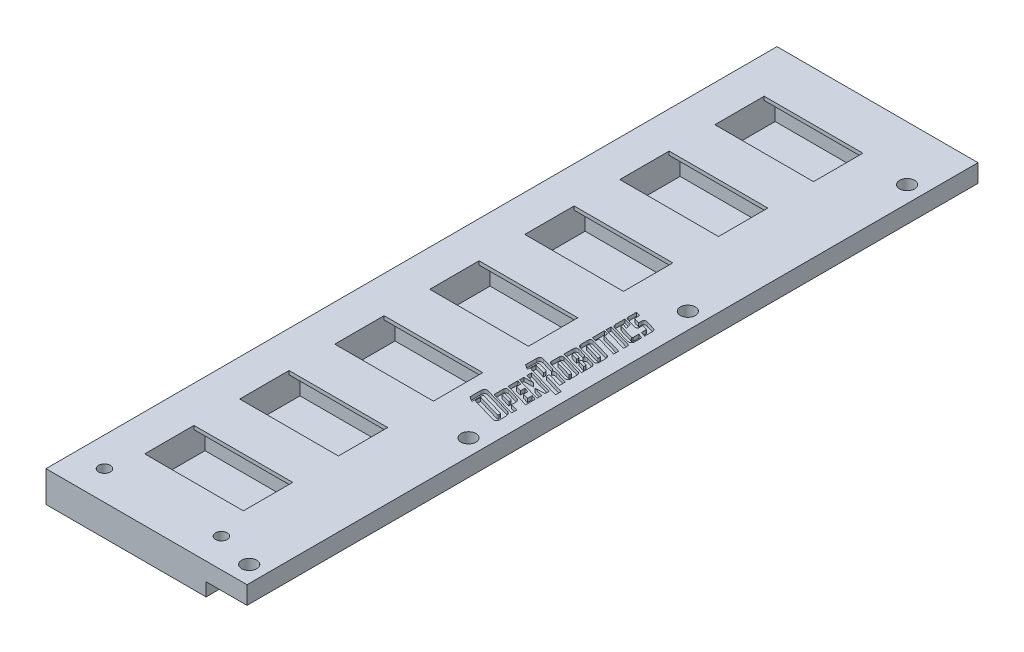
from build123d import *

# Parameters (mm, degrees)
ESQUISSE1_W                = 55
ESQUISSE1_H                = 200
ESQUISSE1_R                = 1.6
BOSS_EXTRU_1_DEPTH         = 8.5
ESQUISSE2_W                = 27
ESQUISSE2_H                = 16.5
ENL_V_MAT_EXTRU_1_DEPTH    = 7.5
ESQUISSE4_W                = 27
ESQUISSE4_H                = 3
BOSS_EXTRU_2_DEPTH         = 1
CONG_1_R                   = 1
R_P_TITION_START           = 10
R_P_TITION_LIN_AIRE4_DEPTH = 27
ESQUISSE8_W                = 11.2
ESQUISSE8_H                = 200
ENL_V_MAT_EXTRU_5_DEPTH    = 3.6
ENL_V_MAT_EXTRU_6_REACH    = 209.483
ESQUISSE9_R                = 2.05
ENL_V_MAT_EXTRU_7_REACH    = 209.599
ESQUISSE10_R               = 1.6
ENL_V_MAT_EXTRU_8_DEPTH    = 1


# Read off the part's stored shape, not the designer's step: Répétition linéaire4
with BuildPart() as part:
    # Esquisse1 → Boss.-Extru.1 (new body)
    with BuildSketch(Plane(origin=(0, 0, 0), x_dir=(1, 0, 0), z_dir=(0, 1, 0))):
        with Locations((27.5, 100)):
            Rectangle(ESQUISSE1_W, ESQUISSE1_H)
        with Locations(Location((8, 8, 0), (0, 0, 270))):
            Circle(ESQUISSE1_R, mode=Mode.SUBTRACT)
    extrude(amount=BOSS_EXTRU_1_DEPTH)

    # Esquisse2 → Enlèv. mat.-Extru.1 (cut)
    with BuildSketch(Plane(origin=(0, 8.5, 0), x_dir=(1, 0, 0), z_dir=(0, 1, 0))):
        with Locations((23.5, 25.25)):
            Rectangle(ESQUISSE2_W, ESQUISSE2_H)
        with Locations((23.5, 51.25)):
            Rectangle(ESQUISSE2_W, ESQUISSE2_H)
        with Locations((23.5, 77.25)):
            Rectangle(ESQUISSE2_W, ESQUISSE2_H)
        with Locations((23.5, 103.25)):
            Rectangle(ESQUISSE2_W, ESQUISSE2_H)
        with Locations((23.5, 129.25)):
            Rectangle(ESQUISSE2_W, ESQUISSE2_H)
        with Locations((23.5, 155.25)):
            Rectangle(ESQUISSE2_W, ESQUISSE2_H)
        with Locations((23.5, 181.25)):
            Rectangle(ESQUISSE2_W, ESQUISSE2_H)
    extrude(amount=-ENL_V_MAT_EXTRU_1_DEPTH, mode=Mode.SUBTRACT)

    # Esquisse4 → Boss.-Extru.2 (add)
    with BuildSketch(Plane(origin=(0, 8.5, 0), x_dir=(1, 0, 0), z_dir=(0, 1, 0))):
        with Locations((23.5, 32)):
            Rectangle(ESQUISSE4_W, ESQUISSE4_H)
        with Locations((23.5, 58)):
            Rectangle(ESQUISSE4_W, ESQUISSE4_H)
        with Locations((23.5, 84)):
            Rectangle(ESQUISSE4_W, ESQUISSE4_H)
        with Locations((23.5, 110)):
            Rectangle(ESQUISSE4_W, ESQUISSE4_H)
        with Locations((23.5, 136)):
            Rectangle(ESQUISSE4_W, ESQUISSE4_H)
        with Locations((23.5, 162)):
            Rectangle(ESQUISSE4_W, ESQUISSE4_H)
        with Locations((23.5, 188)):
            Rectangle(ESQUISSE4_W, ESQUISSE4_H)
    extrude(amount=-BOSS_EXTRU_2_DEPTH)

    # Congé1
    cong_1_edges = [part.edges().sort_by_distance(p)[0] for p in [
        (23.5, 7.5, -33.5),
    ]]
    fillet(cong_1_edges, radius=CONG_1_R)

    # Répétition linéaire4 outline → Répétition linéaire4 (add)
    with BuildSketch(Plane.YZ.offset(R_P_TITION_START)):
        with BuildLine():
            ThreePointArc((7.5, -58.5), (7.207106781, -59.207106781), (6.5, -59.5))
            Line((6.5, -59.5), (7.5, -59.5))
            Line((7.5, -59.5), (7.5, -58.5))
        make_face()
        with BuildLine():
            ThreePointArc((7.5, -84.5), (7.207106781, -85.207106781), (6.5, -85.5))
            Line((6.5, -85.5), (7.5, -85.5))
            Line((7.5, -85.5), (7.5, -84.5))
        make_face()
        with BuildLine():
            ThreePointArc((7.5, -110.5), (7.207106781, -111.207106781), (6.5, -111.5))
            Line((6.5, -111.5), (7.5, -111.5))
            Line((7.5, -111.5), (7.5, -110.5))
        make_face()
        with BuildLine():
            ThreePointArc((7.5, -136.5), (7.207106781, -137.207106781), (6.5, -137.5))
            Line((6.5, -137.5), (7.5, -137.5))
            Line((7.5, -137.5), (7.5, -136.5))
        make_face()
        with BuildLine():
            ThreePointArc((7.5, -162.5), (7.207106781, -163.207106781), (6.5, -163.5))
            Line((6.5, -163.5), (7.5, -163.5))
            Line((7.5, -163.5), (7.5, -162.5))
        make_face()
        with BuildLine():
            ThreePointArc((7.5, -188.5), (7.207106781, -189.207106781), (6.5, -189.5))
            Line((6.5, -189.5), (7.5, -189.5))
            Line((7.5, -189.5), (7.5, -188.5))
        make_face()
    extrude(amount=R_P_TITION_LIN_AIRE4_DEPTH)

    # Esquisse8 → Enlèv. mat.-Extru.5 (cut)
    with BuildSketch(Plane.XZ):
        with Locations((49.4, -100)):
            Rectangle(ESQUISSE8_W, ESQUISSE8_H)
    extrude(amount=-ENL_V_MAT_EXTRU_5_DEPTH, mode=Mode.SUBTRACT)

    # Esquisse9 → Enlèv. mat.-Extru.6 (cut, up to next)
    with BuildSketch(Plane.XZ.offset(-3.6), mode=Mode.PRIVATE) as enl_v_mat_extru_6_sk1:
        with Locations(Location((50.5, -185.1, 0), (0, 0, 270))):
            Circle(ESQUISSE9_R)
    enl_v_mat_extru_6_tool1 = extrude(enl_v_mat_extru_6_sk1.sketch, amount=-ENL_V_MAT_EXTRU_6_REACH, mode=Mode.PRIVATE) & part.part
    # Esquisse9 → Enlèv. mat.-Extru.6 (cut, up to next)
    with BuildSketch(Plane.XZ.offset(-3.6), mode=Mode.PRIVATE) as enl_v_mat_extru_6_sk2:
        with Locations(Location((50.5, -125.1, 0), (0, 0, 270))):
            Circle(ESQUISSE9_R)
    enl_v_mat_extru_6_tool2 = extrude(enl_v_mat_extru_6_sk2.sketch, amount=-ENL_V_MAT_EXTRU_6_REACH, mode=Mode.PRIVATE) & part.part
    # Esquisse9 → Enlèv. mat.-Extru.6 (cut, up to next)
    with BuildSketch(Plane.XZ.offset(-3.6), mode=Mode.PRIVATE) as enl_v_mat_extru_6_sk3:
        with Locations(Location((50.5, -65.1, 0), (0, 0, 270))):
            Circle(ESQUISSE9_R)
    enl_v_mat_extru_6_tool3 = extrude(enl_v_mat_extru_6_sk3.sketch, amount=-ENL_V_MAT_EXTRU_6_REACH, mode=Mode.PRIVATE) & part.part
    # Esquisse9 → Enlèv. mat.-Extru.6 (cut, up to next)
    with BuildSketch(Plane.XZ.offset(-3.6), mode=Mode.PRIVATE) as enl_v_mat_extru_6_sk4:
        with Locations(Location((50.5, -5.1, 0), (0, 0, 270))):
            Circle(ESQUISSE9_R)
    enl_v_mat_extru_6_tool4 = extrude(enl_v_mat_extru_6_sk4.sketch, amount=-ENL_V_MAT_EXTRU_6_REACH, mode=Mode.PRIVATE) & part.part
    add(enl_v_mat_extru_6_tool1.solids().sort_by_distance((50.5, 3.6, -185.1))[0], mode=Mode.SUBTRACT)
    add(enl_v_mat_extru_6_tool2.solids().sort_by_distance((50.5, 3.6, -125.1))[0], mode=Mode.SUBTRACT)
    add(enl_v_mat_extru_6_tool3.solids().sort_by_distance((50.5, 3.6, -65.1))[0], mode=Mode.SUBTRACT)
    add(enl_v_mat_extru_6_tool4.solids().sort_by_distance((50.5, 3.6, -5.1))[0], mode=Mode.SUBTRACT)

    # Esquisse10 → Enlèv. mat.-Extru.7 (cut, up to next)
    with BuildSketch(Plane(origin=(0, 8.5, 0), x_dir=(1, 0, 0), z_dir=(0, 1, 0)), mode=Mode.PRIVATE) as enl_v_mat_extru_7_sk1:
        with Locations(Location((40, 8, 0), (0, 0, 270))):
            Circle(ESQUISSE10_R)
    enl_v_mat_extru_7_tool1 = extrude(enl_v_mat_extru_7_sk1.sketch, amount=-ENL_V_MAT_EXTRU_7_REACH, mode=Mode.PRIVATE) & part.part
    add(enl_v_mat_extru_7_tool1.solids().sort_by_distance((40, 8.5, -8))[0], mode=Mode.SUBTRACT)

    # Esquisse11 → Enlèv. mat.-Extru.8 (cut)
    # profile 1 of 12: a face of its own
    with BuildSketch(Plane(origin=(0, 8.5, 0), x_dir=(1, 0, 0), z_dir=(0, 1, 0))):
        with BuildLine():
            add(Edge.make_bspline(
                [(42.66842272, 77.170687726), (42.643547924, 77.176950055), (42.597373101, 77.18857475), (42.530846571, 77.191819944), (42.473223056, 77.182377769), (42.425768384, 77.155158229), (42.390732732, 77.112821846), (42.364377795, 77.058290871), (42.350823605, 76.989410751), (42.34897761, 76.939226193), (42.347972973, 76.9119145)],
                knots=[0, 0, 0, 0, 1.200744757, 2.228929884, 3.104743097, 3.903101275, 4.735424252, 5.644967986, 6.718332635, 8, 8, 8, 8], degree=3))
            Line((42.347972973, 76.9119145), (42.347972973, 74.168650142))
            Line((42.347972973, 74.168650142), (40.975, 75.021395074))
            Line((40.975, 75.021395074), (40.975, 78.070360446))
            add(Edge.make_bspline(
                [(40.975, 78.070360446), (40.97604752, 78.112868835), (40.97807206, 78.195024722), (40.992995894, 78.313030642), (41.016306747, 78.421754486), (41.052072861, 78.519671666), (41.0940967, 78.610259861), (41.14982605, 78.688788365), (41.213547003, 78.759104447), (41.288040676, 78.817603641), (41.368918052, 78.867111246), (41.45613035, 78.904909914), (41.54786964, 78.93229352), (41.644905599, 78.946366572), (41.746481881, 78.950430318), (41.852844141, 78.94310947), (41.964417743, 78.926299639), (42.038877575, 78.905589102), (42.077132601, 78.894948706)],
                knots=[0, 0, 0, 0, 1.226733108, 2.370904843, 3.42883185, 4.428597837, 5.374906879, 6.301845232, 7.196621362, 8.105333785, 9.025784931, 9.927048389, 10.841512502, 11.781202374, 12.749592323, 13.770854027, 14.854737711, 16, 16, 16, 16], degree=3))
            Line((42.077132601, 78.894948706), (49.490382179, 76.736270496))
            add(Edge.make_bspline(
                [(49.490382179, 76.736270496), (49.538084982, 76.721546836), (49.630566191, 76.693002142), (49.760513344, 76.636056297), (49.877711951, 76.569426876), (49.981170535, 76.491775115), (50.074570001, 76.408744605), (50.155863607, 76.318248297), (50.229200899, 76.224138199), (50.292087605, 76.124696756), (50.346115885, 76.020522282), (50.391402479, 75.912470582), (50.428449061, 75.800056887), (50.462485467, 75.644763325), (50.492820435, 75.446667208), (50.497605357, 75.28655418), (50.5, 75.206424635)],
                knots=[0, 0, 0, 0, 1.055023788, 2.045369839, 2.993742388, 3.899182709, 4.775903371, 5.63226536, 6.467826204, 7.296355253, 8.116431915, 8.946684151, 9.771593619, 10.615292975, 12.306102633, 14, 14, 14, 14], degree=3))
            Line((50.5, 75.206424635), (50.5, 73.779819905))
            add(Edge.make_bspline(
                [(50.5, 73.779819905), (50.498868076, 73.738668509), (50.496658241, 73.658329408), (50.482286899, 73.539974117), (50.454721018, 73.427605995), (50.419417582, 73.320189749), (50.372773363, 73.220971311), (50.315323875, 73.1314478), (50.25007047, 73.049956609), (50.172689387, 72.980159445), (50.086175235, 72.920180848), (49.988997978, 72.872970731), (49.881581169, 72.840383256), (49.765878984, 72.816548038), (49.639653971, 72.809402321), (49.503484732, 72.81642804), (49.356588736, 72.839561242), (49.256863618, 72.866224968), (49.204793074, 72.880147186)],
                knots=[0, 0, 0, 0, 1.038552891, 2.02754736, 3.001378466, 3.953615352, 4.876825356, 5.759105294, 6.632765402, 7.502924438, 8.378838219, 9.281709478, 10.216216551, 11.204889448, 12.255920638, 13.396389907, 14.640549183, 16, 16, 16, 16], degree=3))
            Line((49.204793074, 72.880147186), (42.539706503, 74.845751071))
            Line((42.539706503, 74.845751071), (42.539706503, 76.402412811))
            Line((42.539706503, 76.402412811), (48.887024916, 74.521278942))
            add(Edge.make_bspline(
                [(48.887024916, 74.521278942), (48.905681242, 74.516201599), (48.939947768, 74.506875921), (48.989340682, 74.502453609), (49.032282836, 74.506456191), (49.067693264, 74.523727474), (49.096214969, 74.550358467), (49.114615699, 74.588406387), (49.124839699, 74.635148883), (49.126259447, 74.669153155), (49.127027027, 74.687537388)],
                knots=[0, 0, 0, 0, 1.268310745, 2.32953697, 3.247763845, 4.062404139, 4.872795954, 5.766252807, 6.79233614, 8, 8, 8, 8], degree=3))
            Line((49.127027027, 74.687537388), (49.127027027, 75.066982067))
            add(Edge.make_bspline(
                [(49.127027027, 75.066982067), (49.126206075, 75.085804072), (49.124647072, 75.121547411), (49.114408413, 75.171710691), (49.095775344, 75.214847866), (49.056955457, 75.261465792), (48.988873418, 75.310821809), (48.92408683, 75.333411832), (48.888365709, 75.345867202)],
                knots=[0, 0, 0, 0, 0.845234919, 1.60511692, 2.287910993, 2.930576506, 4.307624333, 6, 6, 6, 6], degree=3))
            Line((48.888365709, 75.345867202), (42.66842272, 77.170687726))
        make_face()
    # profile 2 of 12: a face of its own
    with BuildSketch(Plane(origin=(0, 8.5, 0), x_dir=(1, 0, 0), z_dir=(0, 1, 0))):
        with BuildLine():
            Line((50.5, 78.276842709), (50.5, 76.877053858))
            Line((50.5, 76.877053858), (43.720945946, 78.860088064))
            Line((43.720945946, 78.860088064), (43.720945946, 81.333852844))
            add(Edge.make_bspline(
                [(43.720945946, 81.333852844), (43.721330707, 81.371022369), (43.722062051, 81.441673251), (43.738013078, 81.542102229), (43.759567189, 81.63256567), (43.792344902, 81.712621843), (43.832557632, 81.78299602), (43.879889095, 81.843088839), (43.931112216, 81.895774704), (44.009255055, 81.950946589), (44.120441529, 82.001887428), (44.269688924, 82.025025975), (44.428627625, 82.021853537), (44.534226177, 81.996046317), (44.588439611, 81.982797101)],
                knots=[0, 0, 0, 0, 1.023038278, 1.94456502, 2.796003671, 3.580575649, 4.32004926, 5.022267279, 5.684222913, 6.337178209, 7.649174294, 9.01205071, 10.466011207, 12, 12, 12, 12], degree=3))
            Line((44.588439611, 81.982797101), (47.767461993, 81.056308503))
            add(Edge.make_bspline(
                [(47.767461993, 81.056308503), (47.823748808, 81.037779963), (47.932297814, 81.002047711), (48.077044656, 80.916573116), (48.199380279, 80.81116195), (48.294260184, 80.682251709), (48.368284676, 80.541208541), (48.433005355, 80.394309088), (48.480710275, 80.239350799), (48.526263974, 80.024594398), (48.557236742, 79.749106706), (48.554577153, 79.473942606), (48.542456751, 79.261226594), (48.528252362, 79.11518893), (48.514659694, 78.982654945), (48.501650274, 78.89937521), (48.495513091, 78.860088064)],
                knots=[0, 0, 0, 0, 0.982032393, 1.89384743, 2.772561612, 3.647251032, 4.534363995, 5.415740716, 6.310496145, 7.222190243, 9.060574603, 10.902015397, 11.787137362, 12.599879193, 13.33949416, 14, 14, 14, 14], degree=3))
            Line((48.495513091, 78.860088064), (50.5, 78.276842709))
        make_face()
        with BuildLine():
            add(Edge.make_bspline(
                [(47.469805743, 79.656519652), (47.468013103, 79.689894054), (47.464779206, 79.750100977), (47.433858566, 79.82091728), (47.390284152, 79.860786229), (47.344422907, 79.889718295), (47.28249506, 79.913370407), (47.236141397, 79.927662849), (47.211032517, 79.935404787)],
                knots=[0, 0, 0, 0, 1.424374681, 2.56955061, 3.177697891, 3.925092158, 4.876062669, 6, 6, 6, 6], degree=3))
            Line((47.211032517, 79.935404787), (45.114030828, 80.556192371))
            add(Edge.make_bspline(
                [(45.114030828, 80.556192371), (45.093593608, 80.56143649), (45.055768808, 80.571142201), (45.000393528, 80.573613291), (44.951233046, 80.568474481), (44.908775568, 80.548837333), (44.87504828, 80.516450763), (44.851867652, 80.469891534), (44.837645642, 80.410887371), (44.836892585, 80.366787639), (44.836486486, 80.343006138)],
                knots=[0, 0, 0, 0, 1.160569768, 2.147959388, 3.044020818, 3.860211538, 4.679746554, 5.573090582, 6.691249472, 8, 8, 8, 8], degree=3))
            Line((44.836486486, 80.343006138), (44.836486486, 79.935404787))
            Line((44.836486486, 79.935404787), (47.469805743, 79.15640352))
            Line((47.469805743, 79.15640352), (47.469805743, 79.656519652))
        make_face(mode=Mode.SUBTRACT)
    # profile 3 of 12: a face of its own
    with BuildSketch(Plane(origin=(0, 8.5, 0), x_dir=(1, 0, 0), z_dir=(0, 1, 0))):
        Polygon((43.720945946, 82.72157455), (43.720945946, 85.372324128), (44.922297297, 85.01030977), (44.922297297, 83.768734601), (46.466891892, 83.332976577), (46.466891892, 84.547735868), (47.668243243, 84.195107067), (47.668243243, 82.981688571), (49.212837838, 82.517773875), (49.212837838, 83.806276831), (50.5, 83.342362135), (50.5, 80.738540344), align=None)
    # profile 4 of 12: a face of its own
    with BuildSketch(Plane(origin=(0, 8.5, 0), x_dir=(1, 0, 0), z_dir=(0, 1, 0))):
        Polygon((43.720945946, 85.81076374), (43.720945946, 87.006751915), (46.340857264, 87.052338908), (43.720945946, 87.821954618), (43.720945946, 89.174815682), (50.5, 87.191781476), (50.5, 86.07087776), (47.795618666, 85.950206307), (50.5, 85.143048368), (50.5, 83.827729533), align=None)
    # profile 5 of 12: a face of its own
    with BuildSketch(Plane(origin=(0, 8.5, 0), x_dir=(1, 0, 0), z_dir=(0, 1, 0))):
        with BuildLine():
            add(Edge.make_bspline(
                [(45.351351351, 91.312041189), (45.348014653, 91.353651899), (45.341464909, 91.435331279), (45.297043569, 91.53137732), (45.239194967, 91.596984089), (45.175246565, 91.640559096), (45.094159818, 91.68095492), (45.032147623, 91.700865704), (44.998722551, 91.711597777)],
                knots=[0, 0, 0, 0, 1.288441992, 2.529135953, 3.197061405, 3.982112669, 4.912342488, 6, 6, 6, 6], degree=3))
            Line((44.998722551, 91.711597777), (42.709987331, 92.396743469))
            add(Edge.make_bspline(
                [(42.709987331, 92.396743469), (42.682008144, 92.403970817), (42.630148899, 92.417366661), (42.555061995, 92.422115529), (42.490647017, 92.412608327), (42.437757257, 92.386946762), (42.394752567, 92.347875998), (42.367766241, 92.291375487), (42.349934105, 92.223097335), (42.348658892, 92.172975048), (42.347972973, 92.146015006)],
                knots=[0, 0, 0, 0, 1.270252802, 2.35440548, 3.292793331, 4.102655547, 4.910362279, 5.799571916, 6.816422039, 8, 8, 8, 8], degree=3))
            Line((42.347972973, 92.146015006), (42.347972973, 89.357163655))
            Line((42.347972973, 89.357163655), (40.975, 90.209908588))
            Line((40.975, 90.209908588), (40.975, 93.240102844))
            add(Edge.make_bspline(
                [(40.975, 93.240102844), (40.976024173, 93.282607616), (40.977982219, 93.363869527), (40.992917364, 93.480617367), (41.016969588, 93.587066454), (41.049344828, 93.68422663), (41.094784403, 93.769894809), (41.148318345, 93.845733189), (41.212189051, 93.911453231), (41.286343016, 93.964570429), (41.367432609, 94.007362443), (41.453230436, 94.041150174), (41.544216584, 94.064114014), (41.640113833, 94.076105042), (41.740754193, 94.07678314), (41.846219445, 94.068764522), (41.9562474, 94.050058285), (42.029917791, 94.029606147), (42.067747044, 94.019104111)],
                knots=[0, 0, 0, 0, 1.251338017, 2.392345991, 3.458656697, 4.461694018, 5.397650846, 6.303325578, 7.187420856, 8.082419285, 8.977320952, 9.881560306, 10.791242046, 11.733101695, 12.720213325, 13.749750695, 14.844512033, 16, 16, 16, 16], degree=3))
            Line((42.067747044, 94.019104111), (45.5390625, 92.971944061))
            add(Edge.make_bspline(
                [(45.5390625, 92.971944061), (45.573797573, 92.95932573), (45.643321086, 92.934069682), (45.743043907, 92.88129942), (45.834600029, 92.811442027), (45.923680107, 92.731806156), (46.001943663, 92.631677328), (46.052404783, 92.504017785), (46.085199517, 92.35595463), (46.08841963, 92.24946521), (46.090128801, 92.192942794)],
                knots=[0, 0, 0, 0, 0.858290937, 1.717900535, 2.609056825, 3.527808498, 4.491655234, 5.529494277, 6.688705835, 8, 8, 8, 8], degree=3))
            add(Edge.make_bspline(
                [(46.090128801, 92.192942794), (46.092890034, 92.219459761), (46.09820575, 92.270508197), (46.119027228, 92.342098317), (46.146773047, 92.406463854), (46.184631551, 92.461486999), (46.230356993, 92.508678644), (46.284066978, 92.54778143), (46.34742054, 92.577523836), (46.444079109, 92.605526859), (46.577889572, 92.623151618), (46.749772566, 92.62328656), (46.935095904, 92.596179276), (47.060722476, 92.562974165), (47.1265625, 92.545571594)],
                knots=[0, 0, 0, 0, 0.748345647, 1.440657721, 2.087676751, 2.711702598, 3.307230741, 3.928211305, 4.569097314, 5.26493726, 6.750929821, 8.347168529, 10.08557609, 12, 12, 12, 12], degree=3))
            Line((47.1265625, 92.545571594), (50.5, 91.553384094))
            Line((50.5, 91.553384094), (50.526815878, 89.996722354))
            Line((50.526815878, 89.996722354), (46.83561022, 91.072039077))
            add(Edge.make_bspline(
                [(46.83561022, 91.072039077), (46.814735093, 91.077212639), (46.776027267, 91.086805747), (46.719564773, 91.090088623), (46.66993657, 91.082330775), (46.626918937, 91.063845565), (46.592872733, 91.032090647), (46.567824796, 90.988552418), (46.555999321, 90.931829993), (46.553862932, 90.890619169), (46.552702703, 90.868238402)],
                knots=[0, 0, 0, 0, 1.19988303, 2.224890186, 3.1362273, 3.985590859, 4.798570889, 5.693685216, 6.747486939, 8, 8, 8, 8], degree=3))
            Line((46.552702703, 90.868238402), (46.552702703, 90.404323706))
            Line((46.552702703, 90.404323706), (52.216216216, 88.755147186))
            Line((52.216216216, 88.755147186), (52.216216216, 87.197144652))
            Line((52.216216216, 87.197144652), (42.496801098, 90.034264584))
            Line((42.496801098, 90.034264584), (42.496801098, 91.590926324))
            Line((42.496801098, 91.590926324), (45.351351351, 90.756952506))
            Line((45.351351351, 90.756952506), (45.351351351, 91.312041189))
        make_face()
    # profile 6 of 12: a face of its own
    with BuildSketch(Plane(origin=(0, 8.5, 0), x_dir=(1, 0, 0), z_dir=(0, 1, 0))):
        with BuildLine():
            add(Edge.make_bspline(
                [(43.720945946, 96.744938148), (43.723439452, 96.795792103), (43.728183241, 96.892539598), (43.77338914, 97.027850808), (43.851284077, 97.139991164), (43.95618047, 97.227268846), (44.078701075, 97.288159305), (44.21229502, 97.321305562), (44.353599056, 97.324351314), (44.44659628, 97.302999748), (44.494584037, 97.291982067)],
                knots=[0, 0, 0, 0, 1.09315376, 2.079678722, 3.027820956, 3.998047996, 4.988418342, 5.950537426, 6.942451098, 8, 8, 8, 8], degree=3))
            Line((44.494584037, 97.291982067), (49.781334459, 95.744705885))
            add(Edge.make_bspline(
                [(49.781334459, 95.744705885), (49.815017316, 95.733560726), (49.880626633, 95.711851575), (49.973737159, 95.672248889), (50.056830329, 95.623886382), (50.133912741, 95.574626968), (50.200078412, 95.516444944), (50.260200287, 95.455451423), (50.309291952, 95.386375106), (50.36449885, 95.289456127), (50.418745627, 95.160760146), (50.465523103, 94.999638579), (50.49482817, 94.831790626), (50.49826069, 94.71777636), (50.5, 94.660003604)],
                knots=[0, 0, 0, 0, 0.905611345, 1.763999452, 2.576265425, 3.357825547, 4.094108283, 4.820334349, 5.539174568, 6.249545228, 7.665192868, 9.091283502, 10.526109285, 12, 12, 12, 12], degree=3))
            Line((50.5, 94.660003604), (50.5, 93.001441527))
            add(Edge.make_bspline(
                [(50.5, 93.001441527), (50.497489353, 92.944782122), (50.492579203, 92.833971583), (50.452363095, 92.701821257), (50.408145486, 92.60557246), (50.365683607, 92.540531734), (50.316145824, 92.481071239), (50.25844209, 92.429307984), (50.194571308, 92.383794866), (50.123282687, 92.348212844), (50.045983127, 92.319796202), (49.96289106, 92.299289542), (49.873194741, 92.290423341), (49.778105032, 92.291221428), (49.677978229, 92.307080506), (49.610909546, 92.32463795), (49.57619299, 92.333726155)],
                knots=[0, 0, 0, 0, 1.74875357, 3.420091131, 4.230323309, 5.020366682, 5.815234792, 6.617881247, 7.411907144, 8.234316905, 9.074207126, 9.956175854, 10.873836903, 11.855609175, 12.890005562, 14, 14, 14, 14], degree=3))
            Line((49.57619299, 92.333726155), (44.383298142, 93.854186459))
            add(Edge.make_bspline(
                [(44.383298142, 93.854186459), (44.335320704, 93.86825183), (44.241401498, 93.895785781), (44.112293161, 93.963562113), (43.996894791, 94.048124037), (43.898334061, 94.152470526), (43.817777191, 94.27395812), (43.762735014, 94.412446072), (43.725506573, 94.56420582), (43.722505182, 94.670488278), (43.720945946, 94.725702506)],
                knots=[0, 0, 0, 0, 1.008373918, 1.973962821, 2.929698518, 3.888162458, 4.860278672, 5.856726939, 6.886559729, 8, 8, 8, 8], degree=3))
            Line((43.720945946, 94.725702506), (43.720945946, 96.744938148))
        make_face()
        with BuildLine():
            add(Edge.make_bspline(
                [(44.836486486, 95.290176746), (44.838090859, 95.26019564), (44.840935121, 95.207044543), (44.877306556, 95.138123843), (44.936556577, 95.098324482), (44.980862296, 95.084327315), (45.004085726, 95.076990513)],
                knots=[0, 0, 0, 0, 1.20062907, 2.12849895, 3.019027874, 4, 4, 4, 4], degree=3))
            Line((45.004085726, 95.076990513), (49.21686022, 93.835415344))
            add(Edge.make_bspline(
                [(49.21686022, 93.835415344), (49.241239965, 93.829707538), (49.283840297, 93.819733911), (49.347118077, 93.839170755), (49.381510897, 93.896011512), (49.383377675, 93.939988181), (49.384459459, 93.965472354)],
                knots=[0, 0, 0, 0, 1.140243347, 1.99242222, 2.836622649, 4, 4, 4, 4], degree=3))
            Line((49.384459459, 93.965472354), (49.384459459, 94.326145919))
            add(Edge.make_bspline(
                [(49.384459459, 94.326145919), (49.38263177, 94.353303457), (49.379196963, 94.404341084), (49.347130972, 94.473601632), (49.29012179, 94.524038583), (49.242307053, 94.540145608), (49.21686022, 94.548717709)],
                knots=[0, 0, 0, 0, 1.072414216, 2.015406452, 2.943806376, 4, 4, 4, 4], degree=3))
            Line((49.21686022, 94.548717709), (45.013471284, 95.782248115))
            add(Edge.make_bspline(
                [(45.013471284, 95.782248115), (44.987704451, 95.787525155), (44.942645361, 95.796753245), (44.875806554, 95.775784124), (44.83928796, 95.715683698), (44.837500529, 95.669185063), (44.836486486, 95.642805547)],
                knots=[0, 0, 0, 0, 1.136800501, 1.987950781, 2.858528153, 4, 4, 4, 4], degree=3))
            Line((44.836486486, 95.642805547), (44.836486486, 95.290176746))
        make_face(mode=Mode.SUBTRACT)
    # profile 7 of 12: a face of its own
    with BuildSketch(Plane(origin=(0, 8.5, 0), x_dir=(1, 0, 0), z_dir=(0, 1, 0))):
        with BuildLine():
            Line((43.720945946, 97.995898875), (43.720945946, 100.507205885))
            add(Edge.make_bspline(
                [(43.720945946, 100.507205885), (43.721689383, 100.545664886), (43.72311116, 100.619215394), (43.734614729, 100.724930854), (43.756614194, 100.81981285), (43.783290768, 100.905420111), (43.82194567, 100.979114659), (43.867860736, 101.042862502), (43.921269248, 101.097696762), (44.005691911, 101.152400111), (44.122687546, 101.202606962), (44.27804422, 101.228518058), (44.445607687, 101.224399471), (44.557928517, 101.198062975), (44.616596284, 101.184306814)],
                knots=[0, 0, 0, 0, 1.013406242, 1.93807798, 2.79518693, 3.577247407, 4.293591865, 4.976737941, 5.642924755, 6.296182837, 7.61521801, 8.966660105, 10.415616427, 12, 12, 12, 12], degree=3))
            Line((44.616596284, 101.184306814), (46.680078125, 100.590335108))
            add(Edge.make_bspline(
                [(46.680078125, 100.590335108), (46.710057172, 100.580736017), (46.771809434, 100.560963353), (46.858252124, 100.507935111), (46.940404955, 100.436483136), (47.019572353, 100.349106858), (47.087897816, 100.241651113), (47.133398338, 100.112231868), (47.15555687, 99.963608238), (47.153255486, 99.858769936), (47.152037584, 99.803289077)],
                knots=[0, 0, 0, 0, 0.75721423, 1.55974578, 2.424004557, 3.378518235, 4.395708596, 5.473496848, 6.662964188, 8, 8, 8, 8], degree=3))
            add(Edge.make_bspline(
                [(47.152037584, 99.803289077), (47.154619769, 99.831511484), (47.159534978, 99.885233058), (47.175284592, 99.962149376), (47.200707026, 100.030170121), (47.243360498, 100.108735961), (47.312546703, 100.189731355), (47.417795167, 100.257918171), (47.538510907, 100.296932526), (47.669961228, 100.306410115), (47.804787568, 100.298172092), (47.892822617, 100.276560984), (47.936402027, 100.265862979)],
                knots=[0, 0, 0, 0, 0.789052729, 1.501968106, 2.179443595, 2.803337694, 3.986098257, 5.101292806, 6.254669602, 7.479711303, 8.752398091, 10, 10, 10, 10], degree=3))
            Line((47.936402027, 100.265862979), (49.789379223, 99.710774297))
            add(Edge.make_bspline(
                [(49.789379223, 99.710774297), (49.840921884, 99.692058548), (49.942176659, 99.655291743), (50.081759057, 99.577022523), (50.203456556, 99.478763524), (50.311039885, 99.36385284), (50.396762772, 99.223868505), (50.459021432, 99.057705855), (50.493843792, 98.864384293), (50.497874919, 98.726772949), (50.5, 98.654228689)],
                knots=[0, 0, 0, 0, 0.953310983, 1.872764975, 2.769263557, 3.666605331, 4.599126901, 5.60601987, 6.737970917, 8, 8, 8, 8], degree=3))
            Line((50.5, 98.654228689), (50.5, 96.012864669))
            Line((50.5, 96.012864669), (43.720945946, 97.995898875))
        make_face()
        with BuildLine():
            add(Edge.make_bspline(
                [(46.638513514, 99.005516696), (46.636740722, 99.047300559), (46.633544402, 99.122636321), (46.603002998, 99.211578386), (46.559192418, 99.264732712), (46.513117734, 99.299074178), (46.451592655, 99.32571568), (46.405792497, 99.340683871), (46.381081081, 99.348759939)],
                knots=[0, 0, 0, 0, 1.583880533, 2.855715977, 3.469969509, 4.171781377, 5.013587025, 6, 6, 6, 6], degree=3))
            Line((46.381081081, 99.348759939), (45.122075591, 99.710774297))
            add(Edge.make_bspline(
                [(45.122075591, 99.710774297), (45.101208914, 99.717031496), (45.062611265, 99.728605603), (45.006113885, 99.738465133), (44.956225098, 99.734105535), (44.912340443, 99.721446959), (44.875510549, 99.694014868), (44.851645117, 99.649414846), (44.839569202, 99.591193931), (44.837582643, 99.548153226), (44.836486486, 99.524403942)],
                knots=[0, 0, 0, 0, 1.206047294, 2.230857781, 3.148943057, 3.954536839, 4.731135918, 5.617699683, 6.685478664, 8, 8, 8, 8], degree=3))
            Line((44.836486486, 99.524403942), (44.836486486, 99.071215598))
            Line((44.836486486, 99.071215598), (46.638513514, 98.552328351))
            Line((46.638513514, 98.552328351), (46.638513514, 99.005516696))
        make_face(mode=Mode.SUBTRACT)
        with BuildLine():
            add(Edge.make_bspline(
                [(49.384459459, 98.23724178), (49.382774751, 98.269135313), (49.379588942, 98.329446497), (49.356456688, 98.402008496), (49.321146202, 98.451843723), (49.277663438, 98.483222116), (49.220263674, 98.511075501), (49.176412192, 98.525624419), (49.152502111, 98.533557236)],
                knots=[0, 0, 0, 0, 1.382727979, 2.614760821, 3.238879582, 3.998706708, 4.908792127, 6, 6, 6, 6], degree=3))
            Line((49.152502111, 98.533557236), (47.794277872, 98.93177303))
            add(Edge.make_bspline(
                [(47.794277872, 98.93177303), (47.773859527, 98.937480214), (47.735263358, 98.948268327), (47.67806321, 98.951562871), (47.626122369, 98.948672744), (47.579536848, 98.93457103), (47.540568159, 98.906478004), (47.514328941, 98.862221817), (47.498873553, 98.80452525), (47.497419662, 98.761160703), (47.496621622, 98.737357912)],
                knots=[0, 0, 0, 0, 1.149379209, 2.172636181, 3.098960684, 3.967372639, 4.78391236, 5.64686684, 6.708365695, 8, 8, 8, 8], degree=3))
            Line((47.496621622, 98.737357912), (47.496621622, 98.292214331))
            Line((47.496621622, 98.292214331), (49.384459459, 97.735784854))
            Line((49.384459459, 97.735784854), (49.384459459, 98.23724178))
        make_face(mode=Mode.SUBTRACT)
    # profile 8 of 12: a face of its own
    with BuildSketch(Plane(origin=(0, 8.5, 0), x_dir=(1, 0, 0), z_dir=(0, 1, 0))):
        with BuildLine():
            add(Edge.make_bspline(
                [(43.720945946, 104.639532743), (43.723439452, 104.690386698), (43.728183241, 104.787134193), (43.77338914, 104.922445403), (43.851284077, 105.034585759), (43.95618047, 105.121863441), (44.078701075, 105.1827539), (44.21229502, 105.215900157), (44.353599056, 105.218945909), (44.44659628, 105.197594343), (44.494584037, 105.186576662)],
                knots=[0, 0, 0, 0, 1.09315376, 2.079678722, 3.027820956, 3.998047996, 4.988418342, 5.950537426, 6.942451098, 8, 8, 8, 8], degree=3))
            Line((44.494584037, 105.186576662), (49.781334459, 103.639300479))
            add(Edge.make_bspline(
                [(49.781334459, 103.639300479), (49.815017316, 103.628155321), (49.880626633, 103.606446169), (49.973737159, 103.566843484), (50.056830329, 103.518480977), (50.133912741, 103.469221563), (50.200078412, 103.411039539), (50.260200287, 103.350046017), (50.309291952, 103.2809697), (50.36449885, 103.184050721), (50.418745627, 103.055354741), (50.465523103, 102.894233174), (50.49482817, 102.726385221), (50.49826069, 102.612370955), (50.5, 102.554598199)],
                knots=[0, 0, 0, 0, 0.905611345, 1.763999452, 2.576265425, 3.357825547, 4.094108283, 4.820334349, 5.539174568, 6.249545228, 7.665192868, 9.091283502, 10.526109285, 12, 12, 12, 12], degree=3))
            Line((50.5, 102.554598199), (50.5, 100.896036121))
            add(Edge.make_bspline(
                [(50.5, 100.896036121), (50.497489353, 100.839376717), (50.492579203, 100.728566178), (50.452363095, 100.596415851), (50.408145486, 100.500167054), (50.365683607, 100.435126329), (50.316145824, 100.375665834), (50.25844209, 100.323902579), (50.194571308, 100.278389461), (50.123282687, 100.242807438), (50.045983127, 100.214390797), (49.96289106, 100.193884137), (49.873194741, 100.185017935), (49.778105032, 100.185816022), (49.677978229, 100.201675101), (49.610909546, 100.219232544), (49.57619299, 100.22832075)],
                knots=[0, 0, 0, 0, 1.74875357, 3.420091131, 4.230323309, 5.020366682, 5.815234792, 6.617881247, 7.411907144, 8.234316905, 9.074207126, 9.956175854, 10.873836903, 11.855609175, 12.890005562, 14, 14, 14, 14], degree=3))
            Line((49.57619299, 100.22832075), (44.383298142, 101.748781054))
            add(Edge.make_bspline(
                [(44.383298142, 101.748781054), (44.335320704, 101.762846424), (44.241401498, 101.790380376), (44.112293161, 101.858156707), (43.996894791, 101.942718631), (43.898334061, 102.04706512), (43.817777191, 102.168552715), (43.762735014, 102.307040667), (43.725506573, 102.458800414), (43.722505182, 102.565082872), (43.720945946, 102.620297101)],
                knots=[0, 0, 0, 0, 1.008373918, 1.973962821, 2.929698518, 3.888162458, 4.860278672, 5.856726939, 6.886559729, 8, 8, 8, 8], degree=3))
            Line((43.720945946, 102.620297101), (43.720945946, 104.639532743))
        make_face()
        with BuildLine():
            add(Edge.make_bspline(
                [(44.836486486, 103.184771341), (44.838090859, 103.154790235), (44.840935121, 103.101639138), (44.877306556, 103.032718437), (44.936556577, 102.992919077), (44.980862296, 102.978921909), (45.004085726, 102.971585108)],
                knots=[0, 0, 0, 0, 1.20062907, 2.12849895, 3.019027874, 4, 4, 4, 4], degree=3))
            Line((45.004085726, 102.971585108), (49.21686022, 101.730009939))
            add(Edge.make_bspline(
                [(49.21686022, 101.730009939), (49.241239965, 101.724302132), (49.283840297, 101.714328506), (49.347118077, 101.733765349), (49.381510897, 101.790606106), (49.383377675, 101.834582775), (49.384459459, 101.860066949)],
                knots=[0, 0, 0, 0, 1.140243347, 1.99242222, 2.836622649, 4, 4, 4, 4], degree=3))
            Line((49.384459459, 101.860066949), (49.384459459, 102.220740513))
            add(Edge.make_bspline(
                [(49.384459459, 102.220740513), (49.38263177, 102.247898051), (49.379196963, 102.298935679), (49.347130972, 102.368196227), (49.29012179, 102.418633178), (49.242307053, 102.434740203), (49.21686022, 102.443312304)],
                knots=[0, 0, 0, 0, 1.072414216, 2.015406452, 2.943806376, 4, 4, 4, 4], degree=3))
            Line((49.21686022, 102.443312304), (45.013471284, 103.676842709))
            add(Edge.make_bspline(
                [(45.013471284, 103.676842709), (44.987704451, 103.68211975), (44.942645361, 103.69134784), (44.875806554, 103.670378718), (44.83928796, 103.610278293), (44.837500529, 103.563779657), (44.836486486, 103.537400142)],
                knots=[0, 0, 0, 0, 1.136800501, 1.987950781, 2.858528153, 4, 4, 4, 4], degree=3))
            Line((44.836486486, 103.537400142), (44.836486486, 103.184771341))
        make_face(mode=Mode.SUBTRACT)
    # profile 9 of 12: a face of its own
    with BuildSketch(Plane(origin=(0, 8.5, 0), x_dir=(1, 0, 0), z_dir=(0, 1, 0))):
        Polygon((43.720945946, 105.826135361), (43.720945946, 109.088286966), (44.922297297, 108.726272608), (44.922297297, 107.781012895), (50.5, 106.177423368), (50.5, 104.787020074), (44.922297297, 106.428151831), (44.922297297, 105.464121003), align=None)
    # profile 10 of 12: a face of its own
    with BuildSketch(Plane(origin=(0, 8.5, 0), x_dir=(1, 0, 0), z_dir=(0, 1, 0))):
        Polygon((50.5, 108.947503604), (50.5, 107.511513317), (43.720945946, 109.494547523), (43.720945946, 110.930537811), align=None)
    # profile 11 of 12: a face of its own
    with BuildSketch(Plane(origin=(0, 8.5, 0), x_dir=(1, 0, 0), z_dir=(0, 1, 0))):
        with BuildLine():
            Line((45.800517314, 114.069336375), (46.115603885, 112.716475311))
            Line((46.115603885, 112.716475311), (44.836486486, 113.087875226))
            Line((44.836486486, 113.087875226), (44.836486486, 112.633346088))
            add(Edge.make_bspline(
                [(44.836486486, 112.633346088), (44.837912642, 112.600600693), (44.840422269, 112.542978144), (44.862567182, 112.474681583), (44.897212607, 112.435746447), (44.936035303, 112.414115352), (44.983276039, 112.390651818), (45.020368705, 112.380190502), (45.040287162, 112.374572861)],
                knots=[0, 0, 0, 0, 1.606767423, 2.827452051, 3.416990184, 4.116053493, 4.988336179, 6, 6, 6, 6], degree=3))
            Line((45.040287162, 112.374572861), (48.916522382, 111.233557236))
            add(Edge.make_bspline(
                [(48.916522382, 111.233557236), (48.93959066, 111.226777273), (48.982068819, 111.21429258), (49.043473389, 111.210656631), (49.096635293, 111.215397672), (49.139933292, 111.236750547), (49.174796791, 111.269395739), (49.196285451, 111.315825514), (49.212091513, 111.372409991), (49.212574204, 111.414415543), (49.212837838, 111.437357912)],
                knots=[0, 0, 0, 0, 1.278607248, 2.354440152, 3.268722314, 4.090230118, 4.883188671, 5.768699666, 6.781320228, 8, 8, 8, 8], degree=3))
            Line((49.212837838, 111.437357912), (49.212837838, 112.985974888))
            Line((49.212837838, 112.985974888), (50.5, 112.484517963))
            Line((50.5, 112.484517963), (50.5, 110.659697439))
            add(Edge.make_bspline(
                [(50.5, 110.659697439), (50.499374476, 110.620323603), (50.49814094, 110.542678163), (50.484008302, 110.428867427), (50.462962574, 110.319276179), (50.432318527, 110.214984017), (50.392613827, 110.117081023), (50.342519188, 110.027202), (50.282027663, 109.946500416), (50.211562891, 109.875049729), (50.132062188, 109.811673761), (50.039682006, 109.762996449), (49.93821165, 109.723409273), (49.825608169, 109.696522032), (49.701073446, 109.684023691), (49.564163279, 109.692556782), (49.41498101, 109.71666465), (49.313153828, 109.745110501), (49.259765625, 109.760024719)],
                knots=[0, 0, 0, 0, 1.014028955, 1.999671131, 2.950521351, 3.887036324, 4.795954168, 5.667325384, 6.531052845, 7.386138185, 8.247713242, 9.139246612, 10.06529422, 11.048511357, 12.113074675, 13.277652077, 14.572667322, 16, 16, 16, 16], degree=3))
            Line((49.259765625, 109.760024719), (44.35514147, 111.1973558))
            add(Edge.make_bspline(
                [(44.35514147, 111.1973558), (44.295791224, 111.215936988), (44.184993743, 111.250625113), (44.040685878, 111.328641217), (43.9250292, 111.416507885), (43.842634739, 111.523366783), (43.787792009, 111.644368606), (43.74967829, 111.778242976), (43.724873843, 111.927184895), (43.722294567, 112.031670158), (43.720945946, 112.086302169)],
                knots=[0, 0, 0, 0, 1.241877225, 2.318387522, 3.266890434, 4.127476026, 4.987736175, 5.910457518, 6.907444896, 8, 8, 8, 8], degree=3))
            Line((43.720945946, 112.086302169), (43.720945946, 114.672693638))
            Line((43.720945946, 114.672693638), (45.800517314, 114.069336375))
        make_face()
    # profile 12 of 12: a face of its own
    with BuildSketch(Plane(origin=(0, 8.5, 0), x_dir=(1, 0, 0), z_dir=(0, 1, 0))):
        with BuildLine():
            add(Edge.make_bspline(
                [(44.922297297, 116.285668723), (44.924666888, 116.26130562), (44.929544369, 116.211157487), (44.955253189, 116.151048616), (44.98934453, 116.107921994), (45.024538543, 116.078173465), (45.069704726, 116.054468278), (45.103135787, 116.042553378), (45.120734797, 116.036281054)],
                knots=[0, 0, 0, 0, 1.27739722, 2.629348373, 3.345636298, 4.142615208, 5.022222692, 6, 6, 6, 6], degree=3))
            Line((45.120734797, 116.036281054), (46.517842061, 115.63806526))
            Line((46.517842061, 115.63806526), (46.517842061, 116.387569061))
            add(Edge.make_bspline(
                [(46.517842061, 116.387569061), (46.52007924, 116.446801538), (46.524361936, 116.560191949), (46.559801917, 116.696404127), (46.603187774, 116.791638975), (46.640441851, 116.856157877), (46.686641099, 116.911416453), (46.740000742, 116.959114439), (46.800395351, 117.000016724), (46.870097932, 117.030476085), (46.947000714, 117.053609193), (47.032676433, 117.066499513), (47.127121095, 117.070774915), (47.230536668, 117.062001058), (47.342916536, 117.041097284), (47.41988219, 117.020530181), (47.460420186, 117.009697439)],
                knots=[0, 0, 0, 0, 1.797965636, 3.441896605, 4.232109479, 4.975159624, 5.698586156, 6.410315761, 7.144876479, 7.90474234, 8.712616429, 9.57899681, 10.530611814, 11.57959853, 12.725168697, 14, 14, 14, 14], degree=3))
            Line((47.460420186, 117.009697439), (50.089717061, 116.240081729))
            add(Edge.make_bspline(
                [(50.089717061, 116.240081729), (50.122551907, 116.22899656), (50.186979451, 116.207245576), (50.271949449, 116.150070758), (50.343671401, 116.075546236), (50.399133425, 115.984202569), (50.44390824, 115.885311924), (50.476498915, 115.782711003), (50.4958678, 115.678126713), (50.498617385, 115.60775328), (50.5, 115.572366358)],
                knots=[0, 0, 0, 0, 0.986513593, 1.935707207, 2.893026529, 3.920431044, 4.97199463, 5.989751193, 6.989156642, 8, 8, 8, 8], degree=3))
            Line((50.5, 115.572366358), (50.5, 113.283631138))
            Line((50.5, 113.283631138), (49.212837838, 113.663075817))
            Line((49.212837838, 113.663075817), (49.212837838, 114.830907321))
            add(Edge.make_bspline(
                [(49.212837838, 114.830907321), (49.212570571, 114.860446862), (49.212086916, 114.913902574), (49.203126918, 114.9854829), (49.188836444, 115.041007447), (49.155061016, 115.094975999), (49.08220122, 115.142469037), (49.017135161, 115.168497029), (48.979539696, 115.183536121)],
                knots=[0, 0, 0, 0, 1.130553348, 2.045885943, 2.760910662, 3.307198717, 4.444087195, 6, 6, 6, 6], degree=3))
            Line((48.979539696, 115.183536121), (47.833160895, 115.50800825))
            add(Edge.make_bspline(
                [(47.833160895, 115.50800825), (47.819826544, 115.512899225), (47.797366875, 115.521137322), (47.759892892, 115.522315533), (47.737766361, 115.487248878), (47.73870083, 115.459961225), (47.739305321, 115.442309348)],
                knots=[0, 0, 0, 0, 1.123015174, 1.891546679, 2.636080626, 4, 4, 4, 4], degree=3))
            Line((47.739305321, 115.442309348), (47.739305321, 114.700850311))
            add(Edge.make_bspline(
                [(47.739305321, 114.700850311), (47.738356989, 114.665525207), (47.736552843, 114.598321277), (47.727853681, 114.502209152), (47.710873014, 114.415671134), (47.68505957, 114.339592573), (47.655113075, 114.272122754), (47.615152199, 114.216513789), (47.5696161, 114.169716031), (47.497330754, 114.123010701), (47.391970782, 114.082518136), (47.248454312, 114.068212931), (47.087422414, 114.075558142), (46.977399299, 114.102983088), (46.918739443, 114.117604956)],
                knots=[0, 0, 0, 0, 1.019483306, 1.939506978, 2.781676708, 3.556484021, 4.254513751, 4.902122417, 5.522182858, 6.12662556, 7.371898442, 8.736270326, 10.259911918, 12, 12, 12, 12], degree=3))
            Line((46.918739443, 114.117604956), (44.289442568, 114.887220665))
            add(Edge.make_bspline(
                [(44.289442568, 114.887220665), (44.235031063, 114.907870846), (44.132524535, 114.946773984), (43.999402082, 115.027272966), (43.895023509, 115.121348955), (43.824930675, 115.231737757), (43.779747565, 115.34866853), (43.745578862, 115.467122702), (43.724778021, 115.588620105), (43.722227451, 115.670612692), (43.720945946, 115.711808925)],
                knots=[0, 0, 0, 0, 1.285203468, 2.421211219, 3.421475794, 4.364764557, 5.282689897, 6.187099824, 7.089129151, 8, 8, 8, 8], degree=3))
            Line((43.720945946, 115.711808925), (43.720945946, 117.870487135))
            Line((43.720945946, 117.870487135), (44.922297297, 117.509813571))
            Line((44.922297297, 117.509813571), (44.922297297, 116.285668723))
        make_face()
    extrude(amount=-ENL_V_MAT_EXTRU_8_DEPTH, mode=Mode.SUBTRACT)


solid = part.part
